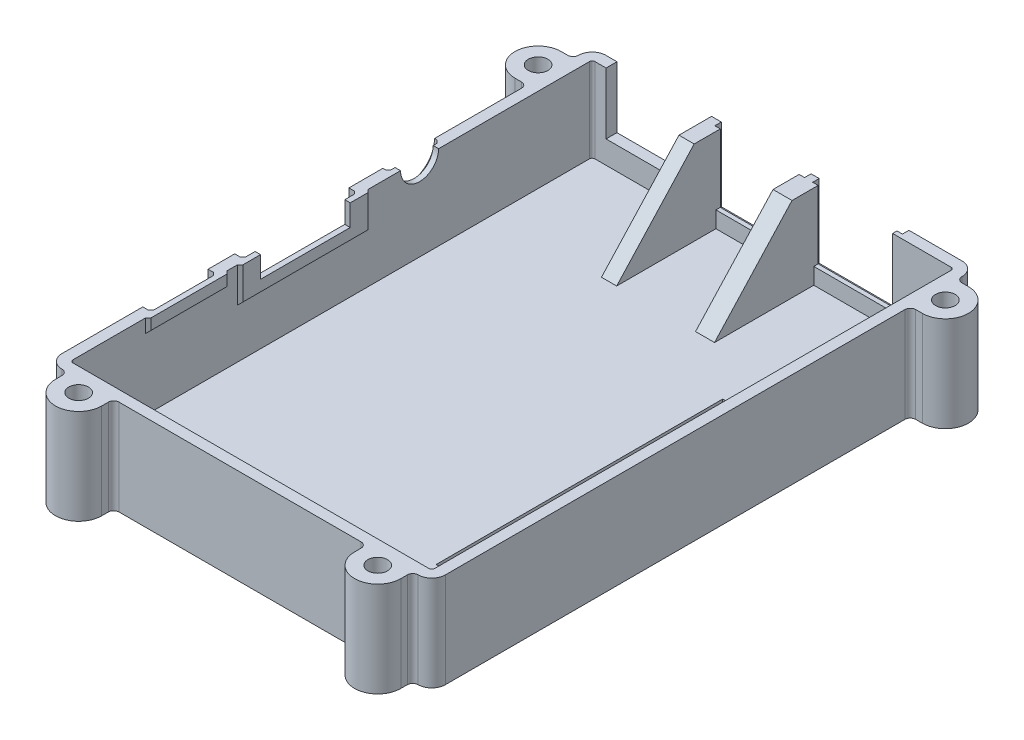
from build123d import *

# Parameters (mm, degrees)
BASE_DEPTH                      = 17.5
SHELL_T                         = -2
CLAMPS_DEPTH                    = 17.5
CLAMP_FILLETS_R                 = 1
SKETCH20_R                      = 1.8
CLAMP_HOLES_DEPTH               = 128.387411073
SKETCH21_R                      = 2.9
CLAMP_COUNTERSINKS_DEPTH        = 3.4
CLAMP_COUNTERSINK_CHAMFERS_SIZE = 0.3
SKETCH24_W                      = 14.5
SKETCH24_H                      = 12.5
USB_CUTOUT_DEPTH                = 18.25
SKETCH25_W                      = 16.5
SKETCH25_H                      = 13.5
USB_APPROACH_DEPTH              = 1.2
USB_INNER_SUPPORT_DEPTH         = 3.5
USB_OUTER_SUPPORT_DEPTH         = 2.8
SKETCH28_W                      = 17.4
SKETCH28_H                      = 11.3
RJ45_CUTOUT_DEPTH               = 22.7
SKETCH29_W                      = 15
SKETCH29_H                      = 2.5
SKETCH29_W_2                    = 24
SKETCH29_H_2                    = 6.43
HDMI_SUPPORT_DEPTH              = 0.5
HDMI_SUPPORT_CHAMFER_SIZE       = 0.5
SKETCH30_W                      = 21
SKETCH30_H                      = 5.93
SKETCH30_W_2                    = 12
SKETCH30_H_2                    = 2
HDMI_APPROACH_DEPTH             = 1.5
SKETCH31_W                      = 16.5
SKETCH31_H                      = 3.93
HDMI_CUTOUT_DEPTH               = 1
HDMI_APPROACH_CHAMFER_SIZE      = 0.5
SKETCH32_R                      = 3.5
AUDIO_CUTOUT_DEPTH              = 2
SKETCH33_R                      = 4.75
AUDIO_APPROACH_DEPTH            = 1
AUDIO_APPROACH_CHAMFER_SIZE     = 0.5
SKETCH34_W                      = 6
SKETCH34_H                      = 52.7
HEADER_CUTOUT_DEPTH             = 2
HEADER_COVER_DEPTH              = 1


with BuildPart() as part:
    # Sketch2 → Base (new body)
    with BuildSketch(Plane(origin=(0, 0, 0), x_dir=(1, 0, 0), z_dir=(0, 1, 0))):
        with BuildLine():
            Line((2.5, 0), (68, 0))
            ThreePointArc((68, 0), (69.767766953, 0.732233047), (70.5, 2.5))
            Line((70.5, 2.5), (70.5, 97.5))
            ThreePointArc((70.5, 97.5), (69.767766953, 99.267766953), (68, 100))
            Line((68, 100), (2.5, 100))
            ThreePointArc((2.5, 100), (0.732233047, 99.267766953), (0, 97.5))
            Line((0, 97.5), (0, 2.5))
            ThreePointArc((0, 2.5), (0.732233047, 0.732233047), (2.5, 0))
        make_face()
    extrude(amount=BASE_DEPTH)

    # Shell
    shell_openings = [part.faces().sort_by_distance(p)[0] for p in [
        (35.25, 17.5, -50),
    ]]
    offset(amount=SHELL_T, openings=shell_openings, kind=Kind.INTERSECTION)

    # Sketch14 → Clamps (add)
    with BuildSketch(Plane.XZ):
        with BuildLine():
            Line((-2.2, -88), (0, -88))
            Line((0, -88), (0, -96.5))
            Line((0, -96.5), (-2.2, -96.5))
            ThreePointArc((-2.2, -96.5), (-6.45, -92.25), (-2.2, -88))
        make_face()
        with BuildLine():
            Line((3.5, 2.2), (3.5, 0))
            Line((3.5, 0), (12, 0))
            Line((12, 0), (12, 2.2))
            ThreePointArc((12, 2.2), (7.75, 6.45), (3.5, 2.2))
        make_face()
        with BuildLine():
            Line((72.7, -88), (70.5, -88))
            Line((70.5, -88), (70.5, -96.5))
            Line((70.5, -96.5), (72.7, -96.5))
            ThreePointArc((72.7, -96.5), (76.95, -92.25), (72.7, -88))
        make_face()
        with BuildLine():
            Line((58.5, 0), (58.5, 2.2))
            ThreePointArc((58.5, 2.2), (62.75, 6.45), (67, 2.2))
            Line((67, 2.2), (67, 0))
            Line((67, 0), (58.5, 0))
        make_face()
    extrude(amount=-CLAMPS_DEPTH)

    # Clamp Fillets
    clamp_fillets_edges = [part.edges().sort_by_distance(p)[0] for p in [
        (0, 8.75, -96.5),
        (0, 8.75, -88),
        (3.5, 8.75, 0),
        (12, 8.75, 0),
        (70.5, 8.75, -88),
        (70.5, 8.75, -96.5),
        (58.5, 8.75, 0),
        (67, 8.75, 0),
    ]]
    fillet(clamp_fillets_edges, radius=CLAMP_FILLETS_R - 0.0001)  # a hair under: the kernel refuses the full size

    # Sketch20 → Clamp Holes (cut, through all)
    with BuildSketch(Plane.XZ):
        with Locations(Location((7.75, 2.2, 0), (0, 0, 270))):
            Circle(SKETCH20_R)
        with Locations(Location((62.75, 2.2, 0), (0, 0, 270))):
            Circle(SKETCH20_R)
        with Locations(Location((72.7, -92.25, 0), (0, 0, 270))):
            Circle(SKETCH20_R)
        with Locations(Location((-2.2, -92.25, 0), (0, 0, 270))):
            Circle(SKETCH20_R)
    extrude(amount=-CLAMP_HOLES_DEPTH, mode=Mode.SUBTRACT)

    # Sketch21 → Clamp Countersinks (cut)
    with BuildSketch(Plane.XZ):
        with Locations(Location((7.75, 2.2, 0), (0, 0, 270))):
            Circle(SKETCH21_R)
        with Locations(Location((62.75, 2.2, 0), (0, 0, 270))):
            Circle(SKETCH21_R)
        with Locations(Location((72.7, -92.25, 0), (0, 0, 270))):
            Circle(SKETCH21_R)
        with Locations(Location((-2.2, -92.25, 0), (0, 0, 270))):
            Circle(SKETCH21_R)
    extrude(amount=-CLAMP_COUNTERSINKS_DEPTH, mode=Mode.SUBTRACT)

    # Clamp Countersink Chamfers
    clamp_countersink_chamfers_edges = [part.edges().sort_by_distance(p)[0] for p in [
        (-2.2, 0, -89.35),
        (72.7, 0, -89.35),
        (62.75, 0, 5.1),
        (7.75, 0, 5.1),
    ]]
    chamfer(clamp_countersink_chamfers_edges, length=CLAMP_COUNTERSINK_CHAMFERS_SIZE)

    # Sketch24 → USB Cutout (cut)
    with BuildSketch(Plane(origin=(0, 0, -100), x_dir=(-1, 0, 0), z_dir=(0, 0, -1))):
        with Locations((-50, 11.25)):
            Rectangle(SKETCH24_W, SKETCH24_H)
        with Locations((-32, 11.25)):
            Rectangle(SKETCH24_W, SKETCH24_H)
    extrude(amount=-USB_CUTOUT_DEPTH, mode=Mode.SUBTRACT)

    # Sketch25 → USB Approach (cut)
    with BuildSketch(Plane(origin=(0, 0, -100), x_dir=(-1, 0, 0), z_dir=(0, 0, -1))):
        with Locations((-50, 10.75)):
            Rectangle(SKETCH25_W, SKETCH25_H)
        with Locations((-32, 10.75)):
            Rectangle(SKETCH25_W, SKETCH25_H)
    extrude(amount=-USB_APPROACH_DEPTH, mode=Mode.SUBTRACT)

    # Sketch26 → USB Inner Support (add)
    with BuildSketch(Plane(origin=(42.75, 0, 0), x_dir=(0, 0, -1), z_dir=(1, 0, 0))):
        Polygon((98, 2), (98, 17.5), (94, 17.5), (79.75, 2), align=None)
    extrude(amount=-USB_INNER_SUPPORT_DEPTH)

    # Sketch27 → USB Outer Support (add)
    with BuildSketch(Plane(origin=(24.75, 0, 0), x_dir=(0, 0, -1), z_dir=(1, 0, 0))):
        Polygon((98, 2), (98, 17.5), (94, 17.5), (79.75, 2), align=None)
    extrude(amount=-USB_OUTER_SUPPORT_DEPTH)

    # Sketch28 → RJ45 Cutout (cut)
    with BuildSketch(Plane(origin=(0, 0, -100), x_dir=(-1, 0, 0), z_dir=(0, 0, -1))):
        with Locations((-13.25, 11.85)):
            Rectangle(SKETCH28_W, SKETCH28_H)
    extrude(amount=-RJ45_CUTOUT_DEPTH, mode=Mode.SUBTRACT)

    # Sketch29 → HDMI Support (add)
    with BuildSketch(Plane(origin=(2, 0, 0), x_dir=(0, 0, -1), z_dir=(1, 0, 0))):
        with Locations((23.35, 16.25)):
            Rectangle(SKETCH29_W, SKETCH29_H)
        with Locations((44.75, 14.285)):
            Rectangle(SKETCH29_W_2, SKETCH29_H_2)
    extrude(amount=HDMI_SUPPORT_DEPTH)

    # HDMI Support Chamfer
    hdmi_support_chamfer_edges = [part.edges().sort_by_distance(p)[0] for p in [
        (2.5, 14.285, -56.75),
        (2.5, 11.07, -44.75),
        (2.5, 14.285, -32.75),
        (2.5, 16.25, -30.85),
        (2.5, 15, -23.35),
        (2.5, 16.25, -15.85),
    ]]
    chamfer(hdmi_support_chamfer_edges, length=HDMI_SUPPORT_CHAMFER_SIZE - 0.0001)  # a hair under: the kernel refuses the full size

    # Sketch30 → HDMI Approach (cut)
    with BuildSketch(Plane.ZY):
        with Locations((-44.75, 14.535)):
            Rectangle(SKETCH30_W, SKETCH30_H)
        with Locations((-23.35, 16.5)):
            Rectangle(SKETCH30_W_2, SKETCH30_H_2)
    extrude(amount=-HDMI_APPROACH_DEPTH, mode=Mode.SUBTRACT)

    # Sketch31 → HDMI Cutout (cut)
    with BuildSketch(Plane.ZY.offset(-1.5)):
        with Locations((-44.75, 15.535)):
            Rectangle(SKETCH31_W, SKETCH31_H)
    extrude(amount=-HDMI_CUTOUT_DEPTH, mode=Mode.SUBTRACT)

    # HDMI Approach Chamfer
    hdmi_approach_chamfer_edges = [part.edges().sort_by_distance(p)[0] for p in [
        (1.5, 14.535, -34.25),
        (1.5, 11.57, -44.75),
        (1.5, 14.535, -55.25),
        (1.5, 16.5, -29.35),
        (1.5, 16.5, -17.35),
        (1.5, 15.5, -23.35),
    ]]
    chamfer(hdmi_approach_chamfer_edges, length=HDMI_APPROACH_CHAMFER_SIZE)

    # Sketch32 → Audio Cutout (cut)
    with BuildSketch(Plane.ZY):
        with Locations((-66.25, 17.5)):
            Circle(SKETCH32_R)
    extrude(amount=-AUDIO_CUTOUT_DEPTH, mode=Mode.SUBTRACT)

    # Sketch33 → Audio Approach (cut)
    with BuildSketch(Plane.ZY):
        with Locations((-66.25, 17.5)):
            Circle(SKETCH33_R)
    extrude(amount=-AUDIO_APPROACH_DEPTH, mode=Mode.SUBTRACT)

    # Audio Approach Chamfer
    audio_approach_chamfer_edges = [part.edges().sort_by_distance(p)[0] for p in [
        (1, 12.75, -66.25),
    ]]
    chamfer(audio_approach_chamfer_edges, length=AUDIO_APPROACH_CHAMFER_SIZE)

    # Sketch34 → Header Cutout (cut)
    with BuildSketch(Plane.XZ):
        with Locations((55.5, -45.15)):
            Rectangle(SKETCH34_W, SKETCH34_H)
    extrude(amount=-HEADER_CUTOUT_DEPTH, mode=Mode.SUBTRACT)

    # Sketch35 → Header Cover (add)
    with BuildSketch(Plane.XZ):
        Polygon((56, -18.8), (55, -18.8), (55, -19.8), (53.5, -19.8), (53.5, -24.7625), (52.5, -24.7625), (52.5, -25.7625), (53.5, -25.7625), (53.5, -37.6875), (52.5, -37.6875), (52.5, -38.6875), (53.5, -38.6875), (53.5, -43.65), (55, -43.65), (55, -44.65), (52.5, -44.65), (52.5, -45.65), (55, -45.65), (55, -46.65), (53.5, -46.65), (53.5, -51.6125), (52.5, -51.6125), (52.5, -52.6125), (53.5, -52.6125), (53.5, -64.5375), (52.5, -64.5375), (52.5, -65.5375), (53.5, -65.5375), (53.5, -70.5), (55, -70.5), (55, -71.5), (56, -71.5), (56, -70.5), (57.5, -70.5), (57.5, -65.5375), (58.5, -65.5375), (58.5, -64.5375), (57.5, -64.5375), (57.5, -52.6125), (58.5, -52.6125), (58.5, -51.6125), (57.5, -51.6125), (57.5, -46.65), (56, -46.65), (56, -45.65), (58.5, -45.65), (58.5, -44.65), (56, -44.65), (56, -43.65), (57.5, -43.65), (57.5, -38.6875), (58.5, -38.6875), (58.5, -37.6875), (57.5, -37.6875), (57.5, -25.7625), (58.5, -25.7625), (58.5, -24.7625), (57.5, -24.7625), (57.5, -19.8), (56, -19.8), align=None)
    extrude(amount=-HEADER_COVER_DEPTH)


solid = part.part
